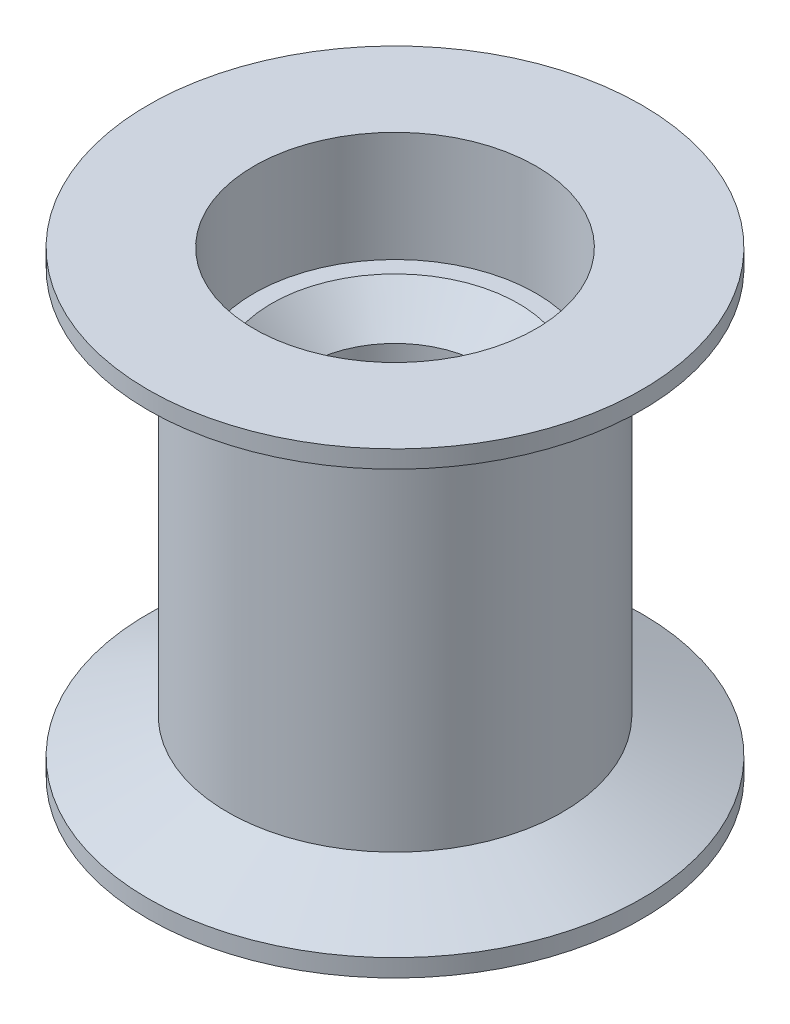
from build123d import *

# Parameters (mm, degrees)
CHAMFER1_SIZE = 1


with BuildPart() as part:
    # Sketch2 → Revolve1 (revolve)
    with BuildSketch(Plane(origin=(0, 0, 0), x_dir=(0, 0, -1), z_dir=(1, 0, 0))):
        Polygon((2.5, 0), (2.5, 3.375), (4, 3.375), (4, 6.5), (7, 6.5), (7, 6), (4.75, 5), (4.75, 0), align=None)
    revolve1 = revolve(axis=Axis((0, 0, 0), (0, 1, 0)))

    # Mirror1: Revolve1 across plane
    add(revolve1.mirror(Plane.ZX))

    # Chamfer1
    chamfer1_edges = [part.edges().sort_by_distance(p)[0] for p in [
        (0, -3.375, 2.5),
        (0, 3.375, 2.5),
    ]]
    chamfer(chamfer1_edges, length=CHAMFER1_SIZE)


solid = part.part
